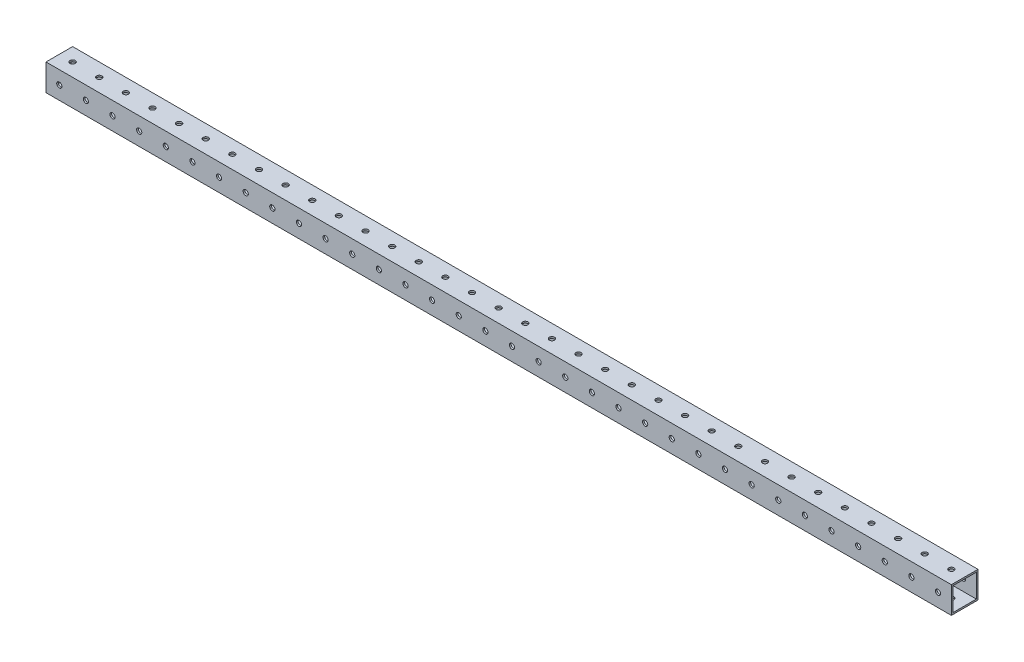
from build123d import *

# Parameters (mm, degrees)
SKETCH1_W             = 25.4
SKETCH1_H             = 25.4
SKETCH1_W_2           = 22.225
SKETCH1_H_2           = 22.225
BOSS_EXTRUDE1_DEPTH   = 431.8
SKETCH3_W             = 2.4892
SKETCH3_H             = 25.4
SKETCH3_AT_POINT_2_W  = 2.4892
SKETCH3_AT_POINT_2_H  = 25.4
LPATTERN1_START       = -12.7
LPATTERN1_OUTLINE_R   = 2.4892
LPATTERN1_DEPTH       = 25.4
LPATTERN1_2_OUTLINE_R = 2.4892
LPATTERN1_2_DEPTH     = 25.4


# Read off the part's stored shape, not the designer's step: LPattern1
with BuildPart() as part:
    # Sketch1 → Boss-Extrude1 (new, symmetric)
    with BuildSketch(Plane(origin=(0, 0, 0), x_dir=(0, 0, -1), z_dir=(1, 0, 0))):
        Rectangle(SKETCH1_W, SKETCH1_H)
        Rectangle(SKETCH1_W_2, SKETCH1_H_2, mode=Mode.SUBTRACT)
    extrude(amount=BOSS_EXTRUDE1_DEPTH, both=True)

    # Sketch3 → #9 (0.196) Diameter Hole1 (revolve, cut)
    with BuildSketch(Plane(origin=(-419.1, 12.7, 0), x_dir=(0, 0, 1), z_dir=(1, 0, 0))):
        with Locations((1.2446, 12.7)):
            Rectangle(SKETCH3_W, SKETCH3_H)
    revolve(axis=Axis((-419.1, 19.05, 0), (0, -1, 0)), mode=Mode.SUBTRACT)

    # Sketch3 at point 2 (carried to point 2, square into its face) → #9 (0.196) Diameter Hole1 at 2 (revolve, cut)
    with BuildSketch(Plane(origin=(-419.1, 0, 12.7), x_dir=(0, -1, 0), z_dir=(1, 0, 0))):
        with Locations((1.2446, 12.7)):
            Rectangle(SKETCH3_AT_POINT_2_W, SKETCH3_AT_POINT_2_H)
    revolve(axis=Axis((-419.1, 0, 19.05), (0, 0, -1)), mode=Mode.SUBTRACT)

    # LPattern1 outline → LPattern1 (cut)
    with BuildSketch(Plane.XY.offset(LPATTERN1_START)):
        with Locations((-393.7, 0)):
            Circle(LPATTERN1_OUTLINE_R)
        with Locations((-368.3, 0)):
            Circle(LPATTERN1_OUTLINE_R)
        with Locations((-342.9, 0)):
            Circle(LPATTERN1_OUTLINE_R)
        with Locations((-317.5, 0)):
            Circle(LPATTERN1_OUTLINE_R)
        with Locations((-292.1, 0)):
            Circle(LPATTERN1_OUTLINE_R)
        with Locations((-266.7, 0)):
            Circle(LPATTERN1_OUTLINE_R)
        with Locations((-241.3, 0)):
            Circle(LPATTERN1_OUTLINE_R)
        with Locations((-215.9, 0)):
            Circle(LPATTERN1_OUTLINE_R)
        with Locations((-190.5, 0)):
            Circle(LPATTERN1_OUTLINE_R)
        with Locations((-165.1, 0)):
            Circle(LPATTERN1_OUTLINE_R)
        with Locations((-139.7, 0)):
            Circle(LPATTERN1_OUTLINE_R)
        with Locations((-114.3, 0)):
            Circle(LPATTERN1_OUTLINE_R)
        with Locations((-88.9, 0)):
            Circle(LPATTERN1_OUTLINE_R)
        with Locations((-63.5, 0)):
            Circle(LPATTERN1_OUTLINE_R)
        with Locations((-38.1, 0)):
            Circle(LPATTERN1_OUTLINE_R)
        with Locations((-12.7, 0)):
            Circle(LPATTERN1_OUTLINE_R)
        with Locations((12.7, 0)):
            Circle(LPATTERN1_OUTLINE_R)
        with Locations((38.1, 0)):
            Circle(LPATTERN1_OUTLINE_R)
        with Locations((63.5, 0)):
            Circle(LPATTERN1_OUTLINE_R)
        with Locations((88.9, 0)):
            Circle(LPATTERN1_OUTLINE_R)
        with Locations((114.3, 0)):
            Circle(LPATTERN1_OUTLINE_R)
        with Locations((139.7, 0)):
            Circle(LPATTERN1_OUTLINE_R)
        with Locations((165.1, 0)):
            Circle(LPATTERN1_OUTLINE_R)
        with Locations((190.5, 0)):
            Circle(LPATTERN1_OUTLINE_R)
        with Locations((215.9, 0)):
            Circle(LPATTERN1_OUTLINE_R)
        with Locations((241.3, 0)):
            Circle(LPATTERN1_OUTLINE_R)
        with Locations((266.7, 0)):
            Circle(LPATTERN1_OUTLINE_R)
        with Locations((292.1, 0)):
            Circle(LPATTERN1_OUTLINE_R)
        with Locations((317.5, 0)):
            Circle(LPATTERN1_OUTLINE_R)
        with Locations((342.9, 0)):
            Circle(LPATTERN1_OUTLINE_R)
        with Locations((368.3, 0)):
            Circle(LPATTERN1_OUTLINE_R)
        with Locations((393.7, 0)):
            Circle(LPATTERN1_OUTLINE_R)
        with Locations((419.1, 0)):
            Circle(LPATTERN1_OUTLINE_R)
    extrude(amount=LPATTERN1_DEPTH, mode=Mode.SUBTRACT)

    # LPattern1 2 outline → LPattern1 2 (cut)
    with BuildSketch(Plane(origin=(0, 0, 0), x_dir=(1, 0, 0), z_dir=(0, 1, 0)).offset(LPATTERN1_START)):
        with Locations((-393.7, 0)):
            Circle(LPATTERN1_2_OUTLINE_R)
        with Locations((-368.3, 0)):
            Circle(LPATTERN1_2_OUTLINE_R)
        with Locations((-342.9, 0)):
            Circle(LPATTERN1_2_OUTLINE_R)
        with Locations((-317.5, 0)):
            Circle(LPATTERN1_2_OUTLINE_R)
        with Locations((-292.1, 0)):
            Circle(LPATTERN1_2_OUTLINE_R)
        with Locations((-266.7, 0)):
            Circle(LPATTERN1_2_OUTLINE_R)
        with Locations((-241.3, 0)):
            Circle(LPATTERN1_2_OUTLINE_R)
        with Locations((-215.9, 0)):
            Circle(LPATTERN1_2_OUTLINE_R)
        with Locations((-190.5, 0)):
            Circle(LPATTERN1_2_OUTLINE_R)
        with Locations((-165.1, 0)):
            Circle(LPATTERN1_2_OUTLINE_R)
        with Locations((-139.7, 0)):
            Circle(LPATTERN1_2_OUTLINE_R)
        with Locations((-114.3, 0)):
            Circle(LPATTERN1_2_OUTLINE_R)
        with Locations((-88.9, 0)):
            Circle(LPATTERN1_2_OUTLINE_R)
        with Locations((-63.5, 0)):
            Circle(LPATTERN1_2_OUTLINE_R)
        with Locations((-38.1, 0)):
            Circle(LPATTERN1_2_OUTLINE_R)
        with Locations((-12.7, 0)):
            Circle(LPATTERN1_2_OUTLINE_R)
        with Locations((12.7, 0)):
            Circle(LPATTERN1_2_OUTLINE_R)
        with Locations((38.1, 0)):
            Circle(LPATTERN1_2_OUTLINE_R)
        with Locations((63.5, 0)):
            Circle(LPATTERN1_2_OUTLINE_R)
        with Locations((88.9, 0)):
            Circle(LPATTERN1_2_OUTLINE_R)
        with Locations((114.3, 0)):
            Circle(LPATTERN1_2_OUTLINE_R)
        with Locations((139.7, 0)):
            Circle(LPATTERN1_2_OUTLINE_R)
        with Locations((165.1, 0)):
            Circle(LPATTERN1_2_OUTLINE_R)
        with Locations((190.5, 0)):
            Circle(LPATTERN1_2_OUTLINE_R)
        with Locations((215.9, 0)):
            Circle(LPATTERN1_2_OUTLINE_R)
        with Locations((241.3, 0)):
            Circle(LPATTERN1_2_OUTLINE_R)
        with Locations((266.7, 0)):
            Circle(LPATTERN1_2_OUTLINE_R)
        with Locations((292.1, 0)):
            Circle(LPATTERN1_2_OUTLINE_R)
        with Locations((317.5, 0)):
            Circle(LPATTERN1_2_OUTLINE_R)
        with Locations((342.9, 0)):
            Circle(LPATTERN1_2_OUTLINE_R)
        with Locations((368.3, 0)):
            Circle(LPATTERN1_2_OUTLINE_R)
        with Locations((393.7, 0)):
            Circle(LPATTERN1_2_OUTLINE_R)
        with Locations((419.1, 0)):
            Circle(LPATTERN1_2_OUTLINE_R)
    extrude(amount=LPATTERN1_2_DEPTH, mode=Mode.SUBTRACT)


solid = part.part
